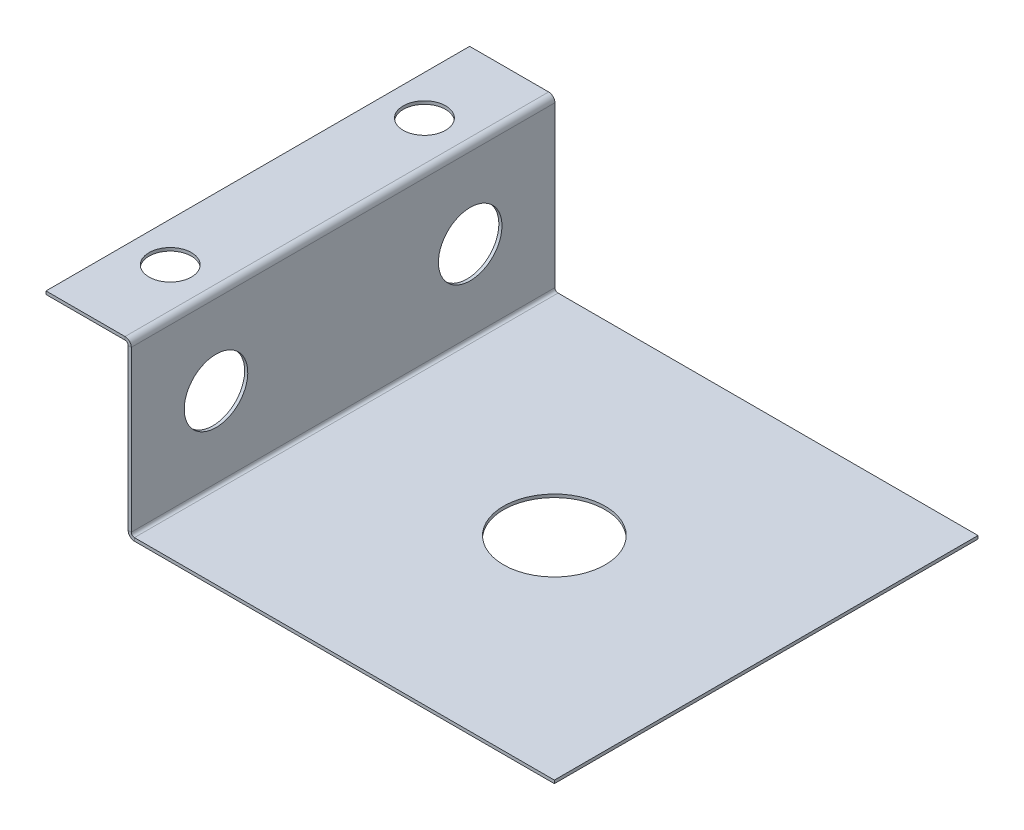
from build123d import *

# Parameters (mm, degrees)
SKETCH5_W               = 120
SKETCH5_H               = 100
BASE_FLANGE1_DEPTH      = 0.7366
JOG1_START              = -50
JOG1_DEPTH              = 100
JOG1_2_DEPTH            = 100
SKETCH15_R              = 12
CUT_EXTRUDE1_DEPTH      = 2
SKETCH21_R              = 5
CUT_EXTRUDE3_DEPTH      = 1.8
CUT_EXTRUDE4_DEPTH      = 2
CUT_EXTRUDE4_DEPTH_BACK = 1.8
SKETCH22_R              = 7.5


# Read off the part's stored shape, not the designer's step: Jog1
# Sheet-metal steps are written as plain solids
with BuildPart() as part:
    # Sketch5 → Base-Flange1 (new body)
    with BuildSketch(Plane(origin=(0, 0, 0), x_dir=(1, 0, 0), z_dir=(0, 1, 0))):
        Rectangle(SKETCH5_W, SKETCH5_H)
    extrude(amount=-BASE_FLANGE1_DEPTH)

    # Jog1 outline → Jog1 (cut)
    with BuildSketch(Plane.XY.offset(JOG1_START)):
        with BuildLine():
            ThreePointArc((-39.132213569, -0.7366), (-39.868813569, -0.539228625), (-40.408042194, 0))
            Line((-40.408042194, 0), (-60, 0))
            Line((-60, 0), (-60, -0.7366))
            Line((-60, -0.7366), (-39.132213569, -0.7366))
        make_face()
    extrude(amount=JOG1_DEPTH, mode=Mode.SUBTRACT)

    # Jog1 2 outline → Jog1 2 (add)
    with BuildSketch(Plane.XY.offset(JOG1_START)):
        with BuildLine():
            Line((-40.605413569, 38.5268), (-40.605413569, 0.7366))
            ThreePointArc((-40.605413569, 0.7366), (-40.555215496, 0.355307783), (-40.408042194, 0))
            Line((-40.408042194, 0), (-39.132213569, 0))
            ThreePointArc((-39.132213569, 0), (-39.653068424, 0.215745145), (-39.868813569, 0.7366))
            Line((-39.868813569, 0.7366), (-39.868813569, 38.5268))
            ThreePointArc((-39.868813569, 38.5268), (-40.300303859, 39.56850971), (-41.342013569, 40))
            Line((-41.342013569, 40), (-60, 40))
            Line((-60, 40), (-60, 39.2634))
            Line((-60, 39.2634), (-41.342013569, 39.2634))
            ThreePointArc((-41.342013569, 39.2634), (-40.821158714, 39.047654855), (-40.605413569, 38.5268))
        make_face()
    extrude(amount=JOG1_2_DEPTH)

    # Sketch15 → Cut-Extrude1 (cut)
    with BuildSketch(Plane(origin=(0, 0, 0), x_dir=(1, 0, 0), z_dir=(0, 1, 0))):
        with Locations(Location((10, 0, 0), (0, 0, 270))):
            Circle(SKETCH15_R)
    extrude(amount=-CUT_EXTRUDE1_DEPTH, mode=Mode.SUBTRACT)

    # Sketch21 → Cut-Extrude3 (cut)
    with BuildSketch(Plane(origin=(0, 40, 0), x_dir=(1, 0, 0), z_dir=(0, 1, 0))):
        with Locations(Location((-50.671006785, 30, 0), (0, 0, 270))):
            Circle(SKETCH21_R)
        with Locations(Location((-50.671006785, -30, 0), (0, 0, 270))):
            Circle(SKETCH21_R)
    extrude(amount=-CUT_EXTRUDE3_DEPTH, mode=Mode.SUBTRACT)

    # Sketch22 → Cut-Extrude4 (cut, two sides: drawn at the far end of the back side and taken through both)
    with BuildSketch(Plane(origin=(-40, 0, 0), x_dir=(0, 0, -1), z_dir=(1, 0, 0)).offset(-CUT_EXTRUDE4_DEPTH_BACK)):
        with Locations(Location((30, 19.6317, 0), (0, 0, 90))):
            Circle(SKETCH22_R)
        with Locations(Location((-30, 19.6317, 0), (0, 0, 90))):
            Circle(SKETCH22_R)
    extrude(amount=CUT_EXTRUDE4_DEPTH + CUT_EXTRUDE4_DEPTH_BACK, mode=Mode.SUBTRACT)


solid = part.part
